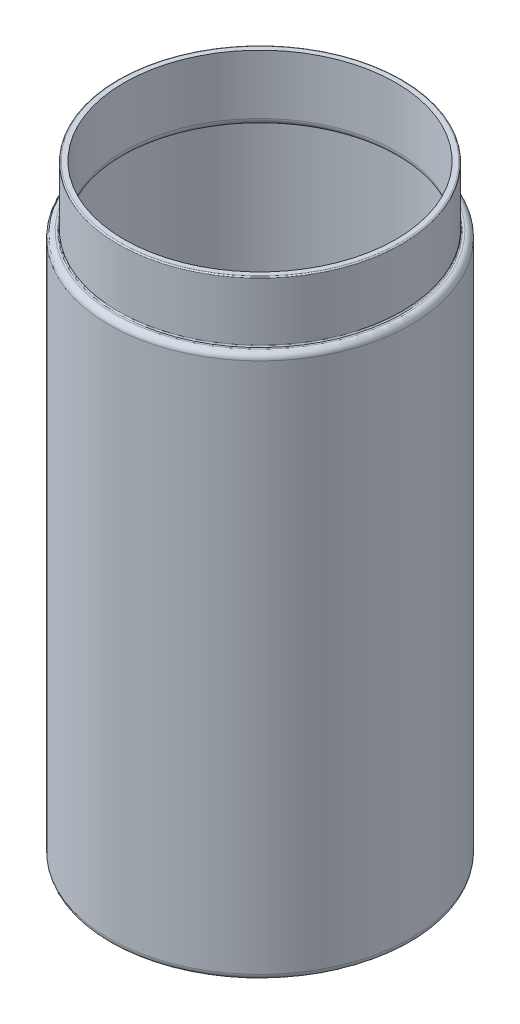
from build123d import *

# Parameters (mm, degrees)
SKETCH1_R           = 25
BOSS_EXTRUDE1_DEPTH = 90
SKETCH2_R           = 23.5
BOSS_EXTRUDE2_DEPTH = 10
FILLET1_R           = 1
FILLET2_R           = 0.2


# Read off the part's stored shape, not the designer's step: Shell1
with BuildPart() as part:
    # Sketch1 → Boss-Extrude1 (new body)
    with BuildSketch(Plane(origin=(0, 0, 0), x_dir=(1, 0, 0), z_dir=(0, 1, 0))):
        with Locations(Location((0, 0, 0), (0, 0, 90))):
            Circle(SKETCH1_R)
    extrude(amount=BOSS_EXTRUDE1_DEPTH)

    # Sketch2 → Boss-Extrude2 (add)
    with BuildSketch(Plane(origin=(0, 90, 0), x_dir=(1, 0, 0), z_dir=(0, 1, 0))):
        with Locations(Location((0, 0, 0), (0, 0, 270))):
            Circle(SKETCH2_R)
    extrude(amount=BOSS_EXTRUDE2_DEPTH)

    # Fillet1
    fillet1_edges = [part.edges().sort_by_distance(p)[0] for p in [
        (0, 0, 25),
        (0, 90, 25),
    ]]
    fillet(fillet1_edges, radius=FILLET1_R)

    # Fillet2
    fillet2_edges = [part.edges().sort_by_distance(p)[0] for p in [
        (0, 90, -23.5),
        (0, 100, -23.5),
    ]]
    fillet(fillet2_edges, radius=FILLET2_R)

    # Shell1 outline → Shell1 (revolve, cut)
    with BuildSketch(Plane.XY):
        with BuildLine():
            Line((24, 1), (24, 89))
            Line((24, 89), (23.7, 89))
            ThreePointArc((23.7, 89), (22.851471863, 89.351471863), (22.5, 90.2))
            Line((22.5, 90.2), (22.5, 100))
            Line((22.5, 100), (0, 100))
            Line((0, 100), (0, 1))
            Line((0, 1), (24, 1))
        make_face()
    revolve(axis=Axis((0, 0, 0), (0, 1, 0)), mode=Mode.SUBTRACT)


solid = part.part
